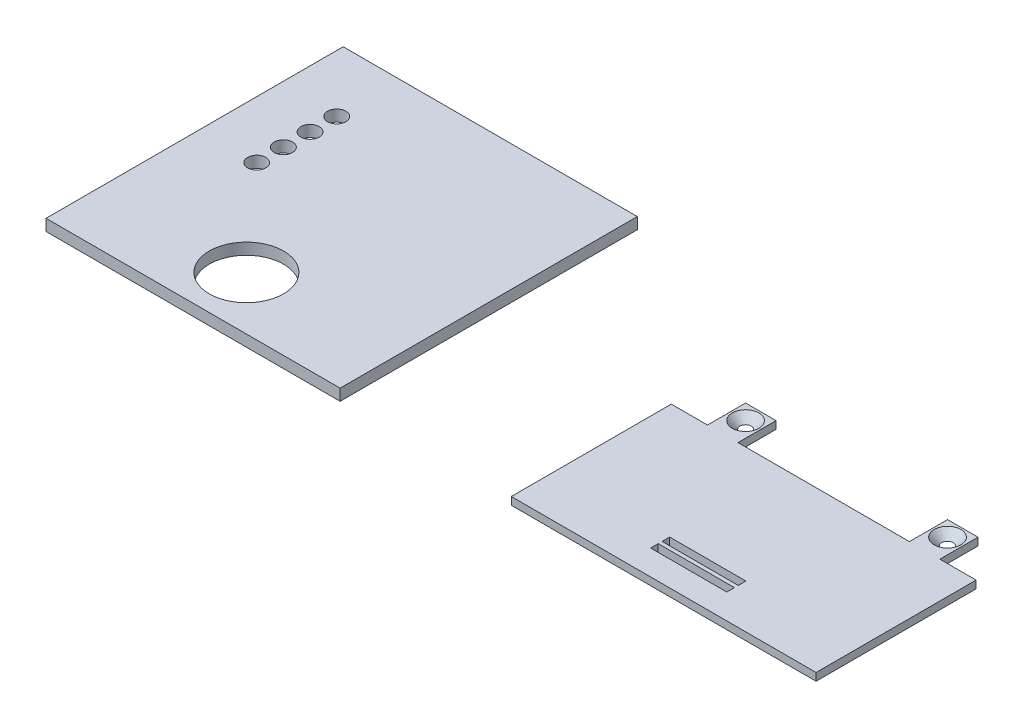
from build123d import *

# Parameters (mm, degrees)
SKETCH_1_W               = 77.2
SKETCH_1_H               = 78
EXTRUDE_1_DEPTH          = 3
CUT_EXTRUDE_1_DEPTH      = 87
CUT_EXTRUDE_1_DEPTH_BACK = 71
SKETCH_2_R               = 9.75
CUT_EXTRUDE_3_DEPTH      = 150
CUT_EXTRUDE_3_DEPTH_BACK = 207
SKETCH_3_R               = 2.4
SKETCH_4_W               = 80
SKETCH_4_H               = 52
EXTRUDE_2_DEPTH          = 2
CUT_EXTRUDE_4_DEPTH      = 35
CUT_EXTRUDE_4_DEPTH_BACK = 32
SKETCH_5_W               = 9.5
SKETCH_5_H               = 10
CUT_EXTRUDE_5_DEPTH      = 54
CUT_EXTRUDE_5_DEPTH_BACK = 45
SKETCH_6_W               = 45
SKETCH_6_H               = 10
CUT_EXTRUDE_6_DEPTH      = 64
CUT_EXTRUDE_6_DEPTH_BACK = 67
SKETCH_7_W               = 9.5
SKETCH_7_H               = 10
CUT_EXTRUDE_7_DEPTH      = 30
CUT_EXTRUDE_7_DEPTH_BACK = 30
SKETCH_8_R               = 1.5
CHAMFER_1_SIZE           = 2
CUT_EXTRUDE_8_DEPTH      = 20
CUT_EXTRUDE_8_DEPTH_BACK = 33
SKETCH_9_R               = 1.5
CHAMFER_2_SIZE           = 2
SKETCH_10_W              = 20
SKETCH_10_H              = 2
CUT_EXTRUDE_9_DEPTH      = 2


with BuildPart() as part:
    # Эскиз1 → Бобышка-Вытянуть1 (new body)
    with BuildSketch(Plane(origin=(0, 0, 0), x_dir=(1, 0, 0), z_dir=(0, 1, 0))):
        with Locations((-119.576362238, 47.549210869)):
            Rectangle(SKETCH_1_W, SKETCH_1_H)
    extrude(amount=EXTRUDE_1_DEPTH)

    # Эскиз2 → Вырез-Вытянуть1 (cut, two sides: drawn at the far end of the back side and taken through both)
    with BuildSketch(Plane(origin=(0, 3, 0), x_dir=(1, 0, 0), z_dir=(0, 1, 0)).offset(-CUT_EXTRUDE_1_DEPTH_BACK)):
        with Locations(Location((-119.576362238, 22.549210869, 0), (0, 0, 270))):
            Circle(SKETCH_2_R)
    extrude(amount=CUT_EXTRUDE_1_DEPTH + CUT_EXTRUDE_1_DEPTH_BACK, mode=Mode.SUBTRACT)

    # Эскиз3 → Вырез-Вытянуть3 (cut, two sides: drawn at the far end of the back side and taken through both)
    with BuildSketch(Plane(origin=(0, 3, 0), x_dir=(1, 0, 0), z_dir=(0, 1, 0)).offset(-CUT_EXTRUDE_3_DEPTH_BACK)):
        with Locations(Location((-143.176362238, 69.855558065, 0), (0, 0, 270))):
            Circle(SKETCH_3_R)
        with Locations(Location((-143.176362238, 62.855558065, 0), (0, 0, 270))):
            Circle(SKETCH_3_R)
        with Locations(Location((-143.176362238, 55.855558065, 0), (0, 0, 270))):
            Circle(SKETCH_3_R)
        with Locations(Location((-143.176362238, 48.855558065, 0), (0, 0, 270))):
            Circle(SKETCH_3_R)
    extrude(amount=CUT_EXTRUDE_3_DEPTH + CUT_EXTRUDE_3_DEPTH_BACK, mode=Mode.SUBTRACT)


with BuildPart() as body_2:
    # Эскиз4 → Бобышка-Вытянуть2 (new body)
    with BuildSketch(Plane(origin=(0, 0, 0), x_dir=(1, 0, 0), z_dir=(0, 1, 0))):
        with Locations((3.117803535, 35.377543141)):
            Rectangle(SKETCH_4_W, SKETCH_4_H)
    extrude(amount=-EXTRUDE_2_DEPTH)

    # Эскиз5 → Вырез-Вытянуть4 (cut, two sides: drawn at the far end of the back side and taken through both)
    with BuildSketch(Plane(origin=(0, 0, 0), x_dir=(1, 0, 0), z_dir=(0, 1, 0)).offset(-CUT_EXTRUDE_4_DEPTH_BACK)):
        with Locations((-32.132196465, 56.377543141)):
            Rectangle(SKETCH_5_W, SKETCH_5_H)
    extrude(amount=CUT_EXTRUDE_4_DEPTH + CUT_EXTRUDE_4_DEPTH_BACK, mode=Mode.SUBTRACT)

    # Эскиз6 → Вырез-Вытянуть5 (cut, two sides: drawn at the far end of the back side and taken through both)
    with BuildSketch(Plane(origin=(0, 0, 0), x_dir=(1, 0, 0), z_dir=(0, 1, 0)).offset(-CUT_EXTRUDE_5_DEPTH_BACK)):
        with Locations((3.117803535, 56.377543141)):
            Rectangle(SKETCH_6_W, SKETCH_6_H)
    extrude(amount=CUT_EXTRUDE_5_DEPTH + CUT_EXTRUDE_5_DEPTH_BACK, mode=Mode.SUBTRACT)

    # Эскиз7 → Вырез-Вытянуть6 (cut, two sides: drawn at the far end of the back side and taken through both)
    with BuildSketch(Plane(origin=(0, 0, 0), x_dir=(1, 0, 0), z_dir=(0, 1, 0)).offset(-CUT_EXTRUDE_6_DEPTH_BACK)):
        with Locations((38.367803535, 56.377543141)):
            Rectangle(SKETCH_7_W, SKETCH_7_H)
    extrude(amount=CUT_EXTRUDE_6_DEPTH + CUT_EXTRUDE_6_DEPTH_BACK, mode=Mode.SUBTRACT)

    # Эскиз8 → Вырез-Вытянуть7 (cut, two sides: drawn at the far end of the back side and taken through both)
    with BuildSketch(Plane(origin=(0, 0, 0), x_dir=(1, 0, 0), z_dir=(0, 1, 0)).offset(-CUT_EXTRUDE_7_DEPTH_BACK)):
        with Locations(Location((-23.382196465, 57.377543141, 0), (0, 0, 270))):
            Circle(SKETCH_8_R)
    extrude(amount=CUT_EXTRUDE_7_DEPTH + CUT_EXTRUDE_7_DEPTH_BACK, mode=Mode.SUBTRACT)

    # Фаска1
    chamfer_1_edges = [body_2.edges().sort_by_distance(p)[0] for p in [
        (-23.382196465, 0, -58.877543141),
    ]]
    chamfer(chamfer_1_edges, length=CHAMFER_1_SIZE - 0.0001)  # a hair under: the kernel refuses the full size

    # Эскиз9 → Вырез-Вытянуть8 (cut, two sides: drawn at the far end of the back side and taken through both)
    with BuildSketch(Plane(origin=(0, 0, 0), x_dir=(1, 0, 0), z_dir=(0, 1, 0)).offset(-CUT_EXTRUDE_8_DEPTH_BACK)):
        with Locations(Location((29.617803535, 57.377543141, 0), (0, 0, 270))):
            Circle(SKETCH_9_R)
    extrude(amount=CUT_EXTRUDE_8_DEPTH + CUT_EXTRUDE_8_DEPTH_BACK, mode=Mode.SUBTRACT)

    # Фаска2
    chamfer_2_edges = [body_2.edges().sort_by_distance(p)[0] for p in [
        (29.617803535, 0, -58.877543141),
    ]]
    chamfer(chamfer_2_edges, length=CHAMFER_2_SIZE - 0.0001)  # a hair under: the kernel refuses the full size

    # Эскиз10 → Вырез-Вытянуть9 (cut)
    with BuildSketch(Plane(origin=(0, 0, 0), x_dir=(1, 0, 0), z_dir=(0, 1, 0))):
        with Locations((3.117803535, 16.946236335)):
            Rectangle(SKETCH_10_W, SKETCH_10_H)
        with Locations((3.117803535, 19.946236335)):
            Rectangle(SKETCH_10_W, SKETCH_10_H)
    extrude(amount=-CUT_EXTRUDE_9_DEPTH, mode=Mode.SUBTRACT)


solid = Compound([part.part, body_2.part])
